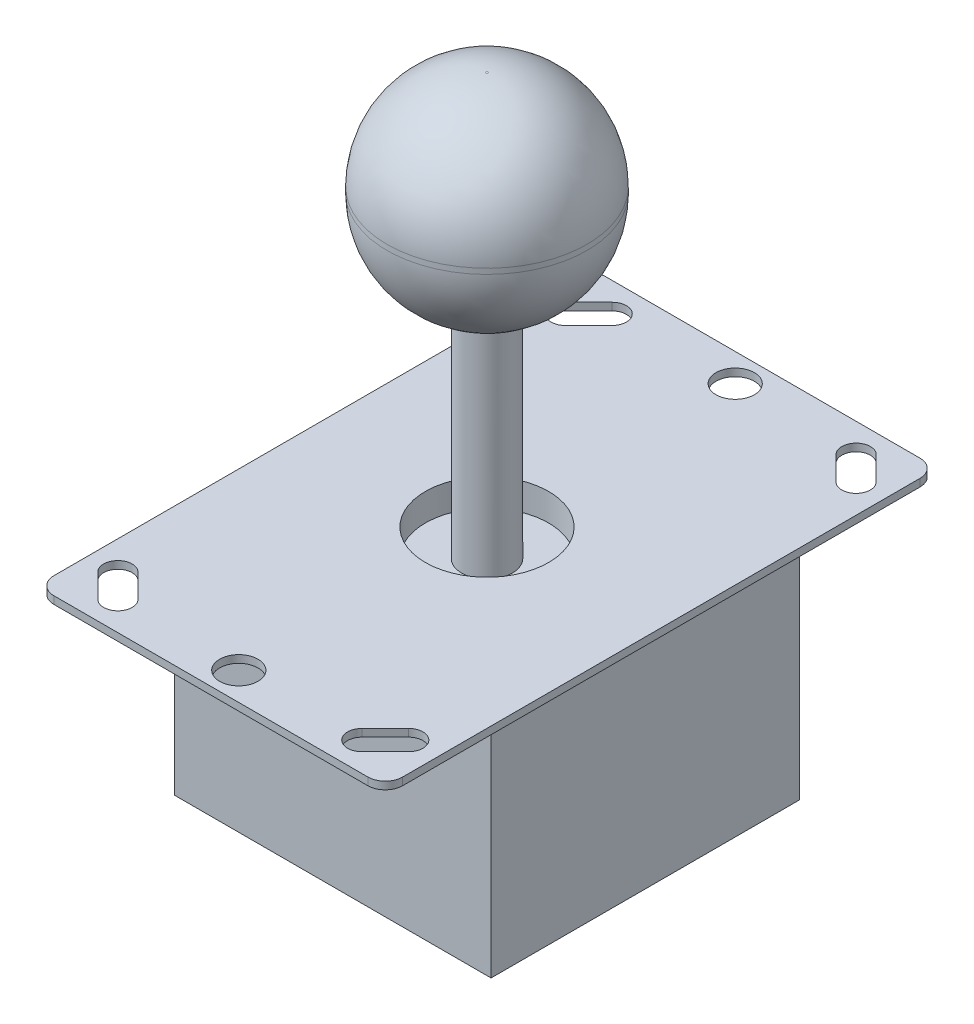
from build123d import *

# Parameters (mm, degrees)
SKETCH1_W                = 60
SKETCH1_H                = 95
BOSS_EXTRUDE1_DEPTH      = 1.3
SKETCH3_W                = 54.5
SKETCH3_H                = 53.1
BOSS_EXTRUDE2_DEPTH      = 39
SKETCH2_R                = 10.6
CUT_EXTRUDE1_DEPTH       = 4.7
SKETCH4_R                = 4.35
BOSS_EXTRUDE3_DEPTH      = 38
SKETCH5_R                = 17.2
BOSS_EXTRUDE4_DEPTH      = 34.4
FILLET1_R                = 17
M6_CLEARANCE_SLOT1_D     = 6.6
M5_CLEARANCE_SLOT1_DEPTH = 1.3
M5_CLEARANCE_SLOT2_DEPTH = 1.3
FILLET2_R                = 3


# Read off the part's stored shape, not the designer's step: M5 Clearance Slot1, M5 Clearance Slot2
with BuildPart() as part:
    # Sketch1 → Boss-Extrude1 (new body)
    with BuildSketch(Plane(origin=(0, 0, 0), x_dir=(1, 0, 0), z_dir=(0, 1, 0))):
        with Locations((30, 47.5)):
            Rectangle(SKETCH1_W, SKETCH1_H)
    extrude(amount=BOSS_EXTRUDE1_DEPTH)

    # Sketch3 → Boss-Extrude2 (add)
    with BuildSketch(Plane.XZ):
        with Locations((30, -47.5)):
            Rectangle(SKETCH3_W, SKETCH3_H)
    extrude(amount=BOSS_EXTRUDE2_DEPTH)

    # Sketch2 → Cut-Extrude1 (cut)
    with BuildSketch(Plane(origin=(0, 1.3, 0), x_dir=(1, 0, 0), z_dir=(0, 1, 0))):
        with Locations(Location((30, 47.5, 0), (0, 0, 270))):
            Circle(SKETCH2_R)
    extrude(amount=-CUT_EXTRUDE1_DEPTH, mode=Mode.SUBTRACT)

    # Sketch4 → Boss-Extrude3 (add)
    with BuildSketch(Plane(origin=(0, -3.4, 0), x_dir=(1, 0, 0), z_dir=(0, 1, 0))):
        with Locations(Location((30, 47.5, 0), (0, 0, 270))):
            Circle(SKETCH4_R)
    extrude(amount=BOSS_EXTRUDE3_DEPTH)

    # Sketch5 → Boss-Extrude4 (add)
    with BuildSketch(Plane(origin=(0, 34.6, 0), x_dir=(1, 0, 0), z_dir=(0, 1, 0))):
        with Locations(Location((30, 47.5, 0), (0, 0, 90))):
            Circle(SKETCH5_R)
    extrude(amount=BOSS_EXTRUDE4_DEPTH)

    # Fillet1
    # the kernel refuses this fillet: 17 mm, written as the material it takes off along each edge
    with BuildSketch(Plane(origin=(30, 34.6, -47.5), x_dir=(0, 0, -1), z_dir=(1, 0, 0))) as fillet1_piece_1:
        with BuildLine():
            CenterArc((0.2, 16.4856756), FILLET1_R, 284.129695419, 75.870304581)
            Line((4.35, 0), (4.433, -0.329713512))
            ThreePointArc((4.433, -0.329713512), (10.775, -0.34), (17.2, -0.34))
            Line((17.2, -0.34), (17.54, 0))
            Line((17.54, 0), (17.54, 16.4856756))
            Line((17.54, 16.4856756), (17.2, 16.4856756))
        make_face()
    revolve(axis=Axis((30, 34.6, -47.5), (0, 1, 0)), mode=Mode.SUBTRACT)
    with BuildSketch(Plane(origin=(30, 69, -47.5), x_dir=(0, 0, -1), z_dir=(1, 0, 0))) as fillet1_piece_2:
        with BuildLine():
            CenterArc((17.2 - FILLET1_R, -FILLET1_R), FILLET1_R, 0, 90)
            Line((17.2 - FILLET1_R, 0), (17.2 - FILLET1_R, FILLET1_R * 0.02))
            Line((17.2 - FILLET1_R, FILLET1_R * 0.02), (17.2, FILLET1_R * 0.02))
            Line((17.2, FILLET1_R * 0.02), (17.2 + FILLET1_R * 0.02, 0))
            Line((17.2 + FILLET1_R * 0.02, 0), (17.2 + FILLET1_R * 0.02, -FILLET1_R))
            Line((17.2 + FILLET1_R * 0.02, -FILLET1_R), (17.2, -FILLET1_R))
        make_face()
    revolve(axis=Axis((30, 69, -47.5), (0, 1, 0)), mode=Mode.SUBTRACT)

    # M6 Clearance Slot1 (through all)
    with Locations(Plane(origin=(0, 1.3, 0), x_dir=(1, 0, 0), z_dir=(0, 1, 0))):
        with Locations((30, 4.8), (30, 90.2)):
            Hole(M6_CLEARANCE_SLOT1_D / 2)

    # M5 Clearance Slot1 outline → M5 Clearance Slot1 (cut)
    with BuildSketch(Plane(origin=(0, 0, 0), x_dir=(1, 0, 0), z_dir=(0, 1, 0))):
        with BuildLine():
            Line((52.717157288, 3.25233406), (56.74766594, 7.282842712))
            ThreePointArc((56.74766594, 7.282842712), (56.74766594, 10.74766594), (53.282842712, 10.74766594))
            Line((53.282842712, 10.74766594), (49.25233406, 6.717157288))
            ThreePointArc((49.25233406, 6.717157288), (49.25233406, 3.25233406), (52.717157288, 3.25233406))
        make_face()
        with BuildLine():
            Line((6.717157288, 84.25233406), (10.74766594, 88.282842712))
            ThreePointArc((10.74766594, 88.282842712), (10.74766594, 91.74766594), (7.282842712, 91.74766594))
            Line((7.282842712, 91.74766594), (3.25233406, 87.717157288))
            ThreePointArc((3.25233406, 87.717157288), (3.25233406, 84.25233406), (6.717157288, 84.25233406))
        make_face()
    extrude(amount=M5_CLEARANCE_SLOT1_DEPTH, mode=Mode.SUBTRACT)

    # M5 Clearance Slot2 outline → M5 Clearance Slot2 (cut)
    with BuildSketch(Plane(origin=(0, 0, 0), x_dir=(1, 0, 0), z_dir=(0, 1, 0))):
        with BuildLine():
            Line((49.25233406, 88.282842712), (53.282842712, 84.25233406))
            ThreePointArc((53.282842712, 84.25233406), (56.74766594, 84.25233406), (56.74766594, 87.717157288))
            Line((56.74766594, 87.717157288), (52.717157288, 91.74766594))
            ThreePointArc((52.717157288, 91.74766594), (49.25233406, 91.74766594), (49.25233406, 88.282842712))
        make_face()
        with BuildLine():
            Line((3.25233406, 7.282842712), (7.282842712, 3.25233406))
            ThreePointArc((7.282842712, 3.25233406), (10.74766594, 3.25233406), (10.74766594, 6.717157288))
            Line((10.74766594, 6.717157288), (6.717157288, 10.74766594))
            ThreePointArc((6.717157288, 10.74766594), (3.25233406, 10.74766594), (3.25233406, 7.282842712))
        make_face()
    extrude(amount=M5_CLEARANCE_SLOT2_DEPTH, mode=Mode.SUBTRACT)

    # Fillet2
    fillet2_edges = [part.edges().sort_by_distance(p)[0] for p in [
        (0, 0.65, -95),
        (60, 0.65, -95),
        (60, 0.65, 0),
        (0, 0.65, 0),
    ]]
    fillet(fillet2_edges, radius=FILLET2_R)


solid = part.part
